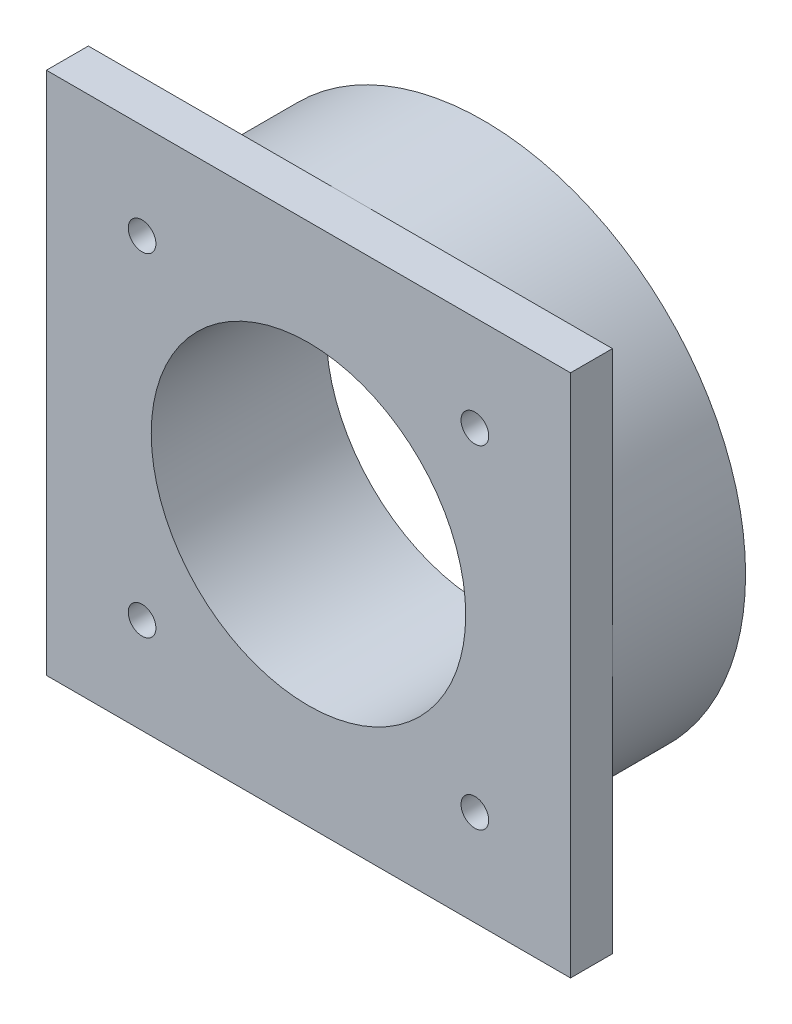
from build123d import *

# Parameters (mm, degrees)
SKETCH1_R           = 25
BOSS_EXTRUDE1_DEPTH = 12.7
SKETCH2_W           = 50
SKETCH2_H           = 50
BOSS_EXTRUDE2_DEPTH = 4
SKETCH3_R           = 1.32
CUT_EXTRUDE1_DEPTH  = 40.101023005
SKETCH4_R           = 15
CUT_EXTRUDE2_DEPTH  = 40.101023005


with BuildPart() as part:
    # Sketch1 → Boss-Extrude1 (new body)
    with BuildSketch(Plane.XY):
        Circle(SKETCH1_R)
    extrude(amount=BOSS_EXTRUDE1_DEPTH)

    # Sketch2 → Boss-Extrude2 (add)
    with BuildSketch(Plane.XY.offset(12.7)):
        Rectangle(SKETCH2_W, SKETCH2_H)
    extrude(amount=BOSS_EXTRUDE2_DEPTH)

    # Sketch3 → Cut-Extrude1 (cut, through all)
    with BuildSketch(Plane.XY.offset(16.7)):
        with Locations((-15.875, 15.875)):
            Circle(SKETCH3_R)
        with Locations((15.875, 15.875)):
            Circle(SKETCH3_R)
        with Locations((15.875, -15.875)):
            Circle(SKETCH3_R)
        with Locations((-15.875, -15.875)):
            Circle(SKETCH3_R)
    extrude(amount=-CUT_EXTRUDE1_DEPTH, mode=Mode.SUBTRACT)

    # Sketch4 → Cut-Extrude2 (cut, through all)
    with BuildSketch(Plane.XY.offset(16.7)):
        Circle(SKETCH4_R)
    extrude(amount=-CUT_EXTRUDE2_DEPTH, mode=Mode.SUBTRACT)


solid = part.part
